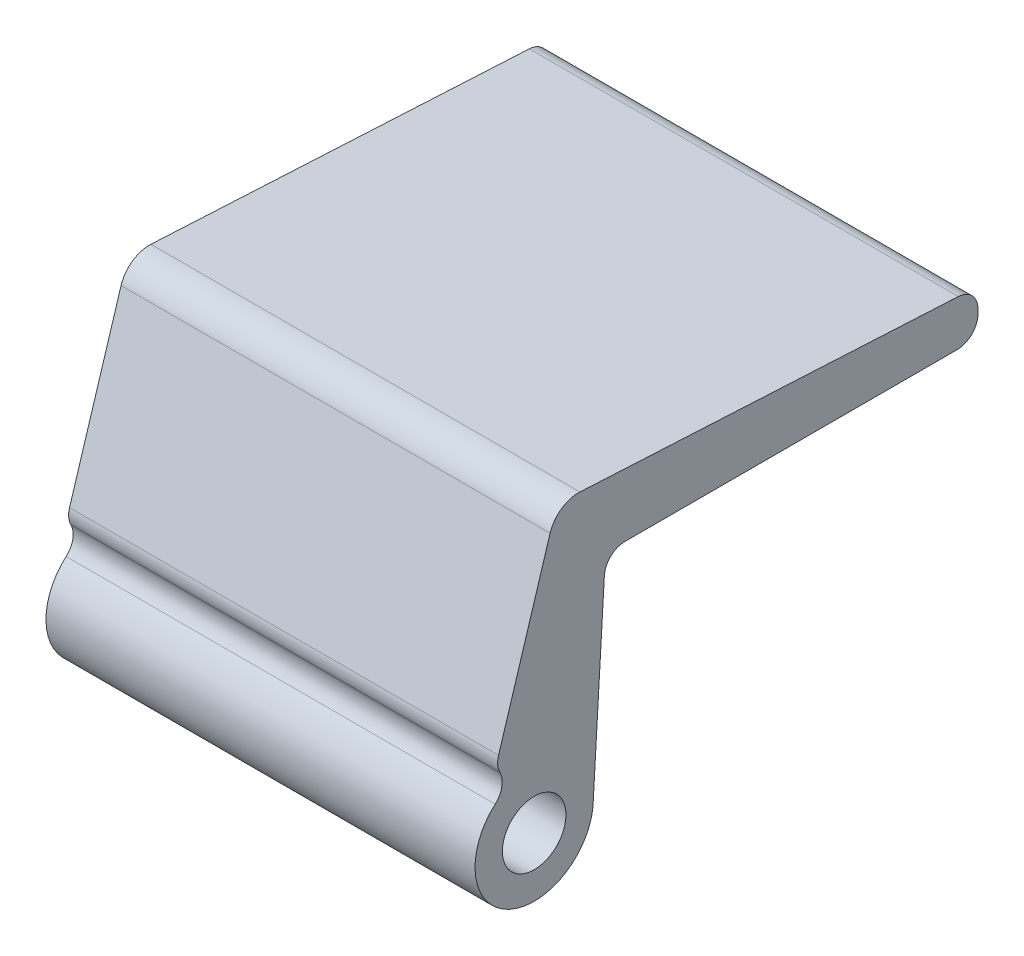
from build123d import *

# Parameters (mm, degrees)
SKETCH1_R           = 2.15
BOSS_EXTRUDE1_DEPTH = 14.5
FILLET1_R           = 2
FILLET2_R           = 1.4


with BuildPart() as part:
    # Sketch1 → Boss-Extrude1 (new, symmetric)
    with BuildSketch(Plane(origin=(0, 0, 0), x_dir=(0, 0, -1), z_dir=(1, 0, 0))):
        with BuildLine():
            Line((1.535973194, 18.500000001), (-2.572234834, 5.219922296))
            Line((-2.572234834, 5.219922296), (-1.768078738, 3.588021398))
            ThreePointArc((-1.768078738, 3.588021398), (-2.112780754, -3.396491934), (3.999999997, 0))
            Line((3.999999997, 0), (4.821445035, 14.000000001))
            Line((4.821445035, 14.000000001), (4.938794327, 14.000000001))
            Line((4.938794327, 14.000000001), (30.000000003, 14.000000001))
            Line((30.000000003, 14.000000001), (30.000000003, 16.000000001))
            Line((30.000000003, 16.000000001), (30.000000003, 17.000000001))
            Line((30.000000003, 17.000000001), (1.535973194, 18.500000001))
        make_face()
        Circle(SKETCH1_R, mode=Mode.SUBTRACT)
    extrude(amount=BOSS_EXTRUDE1_DEPTH, both=True)

    # Fillet1
    fillet1_edges = [part.edges().sort_by_distance(p)[0] for p in [
        (0, 18.500000001, -1.535973194),
    ]]
    fillet(fillet1_edges, radius=FILLET1_R)

    # Fillet2
    fillet2_edges = [part.edges().sort_by_distance(p)[0] for p in [
        (0, 3.588021398, 1.768078738),
        (0, 5.219922296, 2.572234834),
        (0, 14.000000001, -30.000000003),
        (0, 14.000000001, -4.821445035),
        (0, 17.000000001, -30.000000003),
    ]]
    fillet(fillet2_edges, radius=FILLET2_R)


solid = part.part
